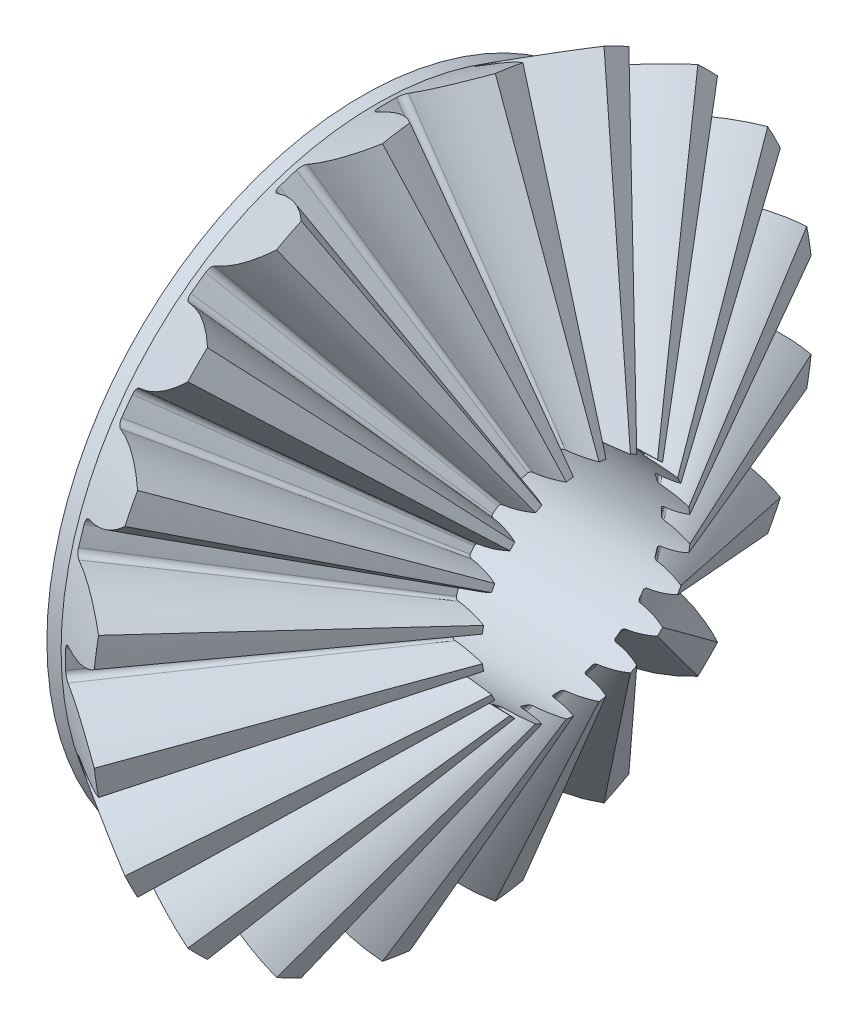
from build123d import *

# Parameters (mm, degrees)
TEETHCUTS_COUNT = 20
TEETHCUTS_ANGLE = 342
HUBSKE_R        = 2.261016722
HUB_DEPTH       = 0.101796136
BORSKE_R        = 0.75
BORE_DEPTH      = 2.0000508


with BuildPart() as part:
    # BasProSke → Base-Revolve (revolve)
    with BuildSketch(Plane(origin=(0, 0, 0), x_dir=(1, 0, 0), z_dir=(0, 1, 0)), mode=Mode.PRIVATE) as base_revolve_sk:
        Polygon((0, 0), (0, 2.261016722), (0.549567216, 2.590757051), (1.763431637, 0.259075703), (1.708474915, 0.226101671), (1.708474915, 0), align=None)
    revolve(base_revolve_sk.sketch.rotate(Axis((-10, 0, 0), (1, 0, 0)), 180), axis=Axis((-10, 0, 0), (1, 0, 0)))

    # ToothCut: read off the stored shape, not the designer's step
    # ToothCut: loft between two sections, ruled curve by curve
    toothcut_from = [
        Edge.make_bspline([(1.906326517, 0.004812632, -0.008590182), (1.901185085, 0.001727772, -0.015119264), (1.893603342, -0.002821273, -0.014484478), (1.889314418, -0.005394628, -0.007165832)], [0, 0, 0, 0, 1, 1, 1, 1], 3, [1, 0.747941435, 0.747941435, 1]),
        Edge.make_bspline([(1.889314418, -0.005394628, 0.007165832), (1.893603342, -0.002821273, 0.014484478), (1.901185085, 0.001727772, 0.015119264), (1.906326517, 0.004812632, 0.008590182)], [0, 0, 0, 0, 1, 1, 1, 1], 3, [1, 0.747941435, 0.747941435, 1]),
        Edge.make_bspline([(1.889314418, -0.005394628, -0.007165832), (1.888700948, -0.00576271, -0.006119003), (1.888227727, -0.006046642, -0.004977458), (1.88790527, -0.006240116, -0.003766562)], [0, 0, 0, 0, 1, 1, 1, 1], 3, [1, 0.992593456, 0.992593456, 1]),
        Edge.make_bspline([(1.88790527, -0.006240116, 0.003766562), (1.888227727, -0.006046642, 0.004977458), (1.888700948, -0.00576271, 0.006119003), (1.889314418, -0.005394628, 0.007165832)], [0, 0, 0, 0, 1, 1, 1, 1], 3, [1, 0.992593456, 0.992593456, 1]),
        Edge.make_bspline([(1.88790527, -0.006240116, -0.003766562), (1.887246928, -0.006635122, -0.001294344), (1.887246928, -0.006635122, 0.001294344), (1.88790527, -0.006240116, 0.003766562)], [0, 0, 0, 0, 1, 1, 1, 1], 3, [1, 0.970005404, 0.970005404, 1]),
        Edge.make_line((1.906326517, 0.004812632, 0.008590182), (1.906326517, 0.004812632, -0.008590182)),
    ]
    toothcut_to = [
        Edge.make_bspline([(0.577253369, 2.607368742, -0.339882132), (0.445058055, 2.528051555, -0.212107702), (0.286655489, 2.433010015, -0.134849338), (0.115818186, 2.330507633, -0.114824367)], [0, 0, 0, 0, 1, 1, 1, 1], 3, [1, 0.971017904, 0.971017904, 1]),
        Edge.make_bspline([(0.115818186, 2.330507633, 0.114824367), (0.286655489, 2.433010015, 0.134849338), (0.445058055, 2.528051555, 0.212107702), (0.577253369, 2.607368742, 0.339882132)], [0, 0, 0, 0, 1, 1, 1, 1], 3, [1, 0.971017904, 0.971017904, 1]),
        Edge.make_bspline([(0.115818186, 2.330507633, -0.114824367), (0.093127334, 2.316893123, -0.112164622), (0.078091654, 2.307871714, -0.092168463), (0.078794387, 2.308293354, -0.065585908)], [0, 0, 0, 0, 1, 1, 1, 1], 3, [1, 0.820798626, 0.820798626, 1]),
        Edge.make_bspline([(0.078794387, 2.308293354, 0.065585908), (0.078091654, 2.307871714, 0.092168463), (0.093127334, 2.316893123, 0.112164622), (0.115818186, 2.330507633, 0.114824367)], [0, 0, 0, 0, 1, 1, 1, 1], 3, [1, 0.820798626, 0.820798626, 1]),
        Edge.make_bspline([(0.078794387, 2.308293354, -0.065585908), (0.079950086, 2.308986774, -0.021868893), (0.079950086, 2.308986774, 0.021868893), (0.078794387, 2.308293354, 0.065585908)], [0, 0, 0, 0, 1, 1, 1, 1], 3, [1, 0.999683411, 0.999683411, 1]),
        Edge.make_line((0.577253369, 2.607368742, 0.339882132), (0.577253369, 2.607368742, -0.339882132)),
    ]
    toothcut = Solid(Shell([*[Face.make_surface_from_curves(toothcut_from[k], toothcut_to[k]) for k in range(6)], Face(Wire(toothcut_from)), Face(Wire(toothcut_to))]))
    add(toothcut, mode=Mode.SUBTRACT)

    # TeethCuts: ToothCut ×20 about axis
    teethcuts_axis = Axis((-10, 0, 0), (1, 0, 0))
    for i in range(1, TEETHCUTS_COUNT):
        add(toothcut.rotate(teethcuts_axis, i * TEETHCUTS_ANGLE / (TEETHCUTS_COUNT - 1)), mode=Mode.SUBTRACT)

    # HubSke → Hub (add)
    with BuildSketch(Plane.ZY):
        Circle(HUBSKE_R)
    extrude(amount=HUB_DEPTH)

    # BorSke → Bore (cut, symmetric)
    with BuildSketch(Plane(origin=(0, 0, 0), x_dir=(0, 0, -1), z_dir=(1, 0, 0))):
        with Locations(Location((0, 0, 0), (0, 0, 180))):
            Circle(BORSKE_R)
    extrude(amount=BORE_DEPTH, both=True, mode=Mode.SUBTRACT)


solid = part.part
